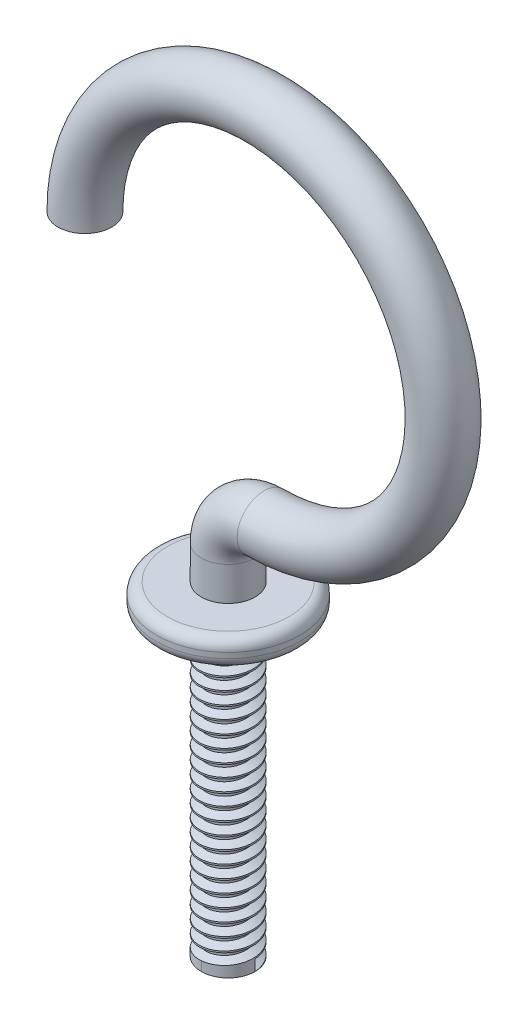
from build123d import *

# Parameters (mm, degrees)
VARREDURA1_PROFILE_R     = 0.75
ROSCA1_PITCH             = 0.35
RESSALTO_EXTRUS_O1_START = 8.30577
ESBO_O2_R                = 2
RESSALTO_EXTRUS_O1_DEPTH = 0.75
FILETE1_R                = 0.3


with BuildPart() as part:
    # Varredura1: sweep along a path in Esboço1
    with BuildLine(Plane.XY) as varredura1_path:
        Line((0, 0), (0, 10))
        ThreePointArc((0, 10), (0.292893219, 10.707106781), (1, 11))
        ThreePointArc((1, 11), (4.535533906, 19.535533906), (-4, 16))
    # Varredura1 profile (on start of the path) → Varredura1 (sweep)
    with BuildSketch(Plane.ZX):
        Circle(VARREDURA1_PROFILE_R)
    sweep(path=varredura1_path.line)

    # Rosca1: the profile of Perfil da rosca1 profile screwed along a right-hand helix of 22.857143 turns, 6 arcs to a turn; built about Z, then put on its axis
    rosca1_z = Axis((0, 0, 0), (0, 0, 1))
    rosca1_corners = [(0.7503, 0, -0.000173205), (0.7503, 0, 0.306423204), (0.560556944, 0, 0.196875), (0.560556944, 0, 0.109375)]
    with BuildLine(mode=Mode.PRIVATE) as rosca1_profile:
        Line(rosca1_corners[0], rosca1_corners[1])
        Line(rosca1_corners[1], rosca1_corners[2])
        Line(rosca1_corners[2], rosca1_corners[3])
        Line(rosca1_corners[3], rosca1_corners[0])
    rosca1_cap = Face(rosca1_profile.wire())
    rosca1_turn_angles = [0, 30, 60, 90, 120, 150, 180, 210, 240, 270, 300, 330, 360]
    rosca1_turn_weights = [1, 0.8660254037844387, 1, 0.8660254037844387, 1, 0.8660254037844387, 1, 0.8660254037844387, 1, 0.8660254037844387, 1, 0.8660254037844387, 1]
    rosca1_turn_rails = [Edge.make_bspline([Vector(p[0], p[1], 0).rotate(rosca1_z, rosca1_turn_angles[k]) / rosca1_turn_weights[k] + Vector(0, 0, p[2] + ROSCA1_PITCH * rosca1_turn_angles[k] / 360) for k in range(13)], [0, 0, 0, 1, 1, 2, 2, 3, 3, 4, 4, 5, 5, 6, 6, 6], 2, rosca1_turn_weights) for p in rosca1_corners]
    rosca1_turn_sides = [Face.make_surface_from_curves(rosca1_turn_rails[p[0]], rosca1_turn_rails[p[1]]) for p in [(0, 1), (1, 2), (2, 3), (3, 0)]]
    rosca1_last_angles = [7920, 7950, 7980, 8010, 8040, 8070, 8100, 8130, 8160, 8190, 8220, 8224.285714286, 8228.571428571]
    rosca1_last_weights = [1, 0.8660254037844387, 1, 0.8660254037844387, 1, 0.8660254037844387, 1, 0.8660254037844387, 1, 0.8660254037844387, 1, 0.9972037971811797, 1]
    rosca1_last_rails = [Edge.make_bspline([Vector(p[0], p[1], 0).rotate(rosca1_z, rosca1_last_angles[k]) / rosca1_last_weights[k] + Vector(0, 0, p[2] + ROSCA1_PITCH * rosca1_last_angles[k] / 360) for k in range(13)], [0, 0, 0, 1, 1, 2, 2, 3, 3, 4, 4, 5, 5, 6, 6, 6], 2, rosca1_last_weights) for p in rosca1_corners]
    rosca1_last_sides = [Face.make_surface_from_curves(rosca1_last_rails[p[0]], rosca1_last_rails[p[1]]) for p in [(0, 1), (1, 2), (2, 3), (3, 0)]]
    rosca1 = Plane(origin=(0, 0, 0), x_dir=(1, 0, 0), z_dir=(0, 1, 0)) * Solid(Shell([*[p.moved(Location((0, 0, ROSCA1_PITCH * i))) for i in range(22) for p in rosca1_turn_sides], *rosca1_last_sides, rosca1_cap, rosca1_cap.rotate(rosca1_z, 8228.571428571).moved(Location((0, 0, ROSCA1_PITCH * 8228.571428571 / 360)))]))
    add(rosca1, mode=Mode.SUBTRACT)


with BuildPart() as body_2:
    # Esboço2 → Ressalto-extrusão1 (new body)
    with BuildSketch(Plane(origin=(0, 0, 0), x_dir=(1, 0, 0), z_dir=(0, 1, 0)).offset(RESSALTO_EXTRUS_O1_START)):
        with Locations(Location((0, 0, 0), (0, 0, 270))):
            Circle(ESBO_O2_R)
    extrude(amount=RESSALTO_EXTRUS_O1_DEPTH)

    # Filete1
    filete1_edges = [body_2.edges().sort_by_distance(p)[0] for p in [
        (0, 8.30577, -2),
        (0, 9.05577, -2),
    ]]
    fillet(filete1_edges, radius=FILETE1_R)


solid = Compound([part.part, body_2.part])
